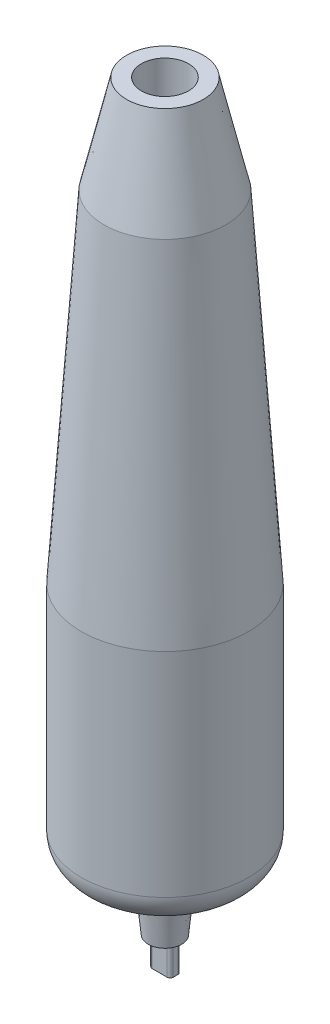
from build123d import *

# Parameters (mm, degrees)
FILLET1_R           = 10
SKETCH3_W           = 7
SKETCH3_H           = 3.55
BOSS_EXTRUDE2_DEPTH = 10
FILLET2_R           = 1


with BuildPart() as part:
    # Sketch2 → Revolve1 (revolve)
    with BuildSketch(Plane.XY):
        Polygon((0, 0), (5.5, 0), (7.5, 20), (27.5, 20), (27.5, 100), (20, 212), (12.6, 244), (7.75, 244), (7.75, 229), (0, 229), align=None)
    revolve(axis=Axis((0, 229, 0), (0, -1, 0)))

    # Fillet1
    fillet1_edges = [part.edges().sort_by_distance(p)[0] for p in [
        (-27.5, 20, 0),
    ]]
    fillet(fillet1_edges, radius=FILLET1_R)

    # Sketch3 → Boss-Extrude2 (add)
    with BuildSketch(Plane.XZ):
        Rectangle(SKETCH3_W, SKETCH3_H)
    extrude(amount=BOSS_EXTRUDE2_DEPTH)

    # Fillet2
    fillet2_edges = [part.edges().sort_by_distance(p)[0] for p in [
        (3.5, 0, 0),
        (0, 0, 1.775),
        (0, 0, -1.775),
        (-3.5, -5, 1.775),
        (-3.5, -10, 0),
        (-3.5, -5, -1.775),
        (-3.5, 0, 0),
        (3.5, -5, -1.775),
        (3.5, -5, 1.775),
    ]]
    fillet(fillet2_edges, radius=FILLET2_R)


solid = part.part
